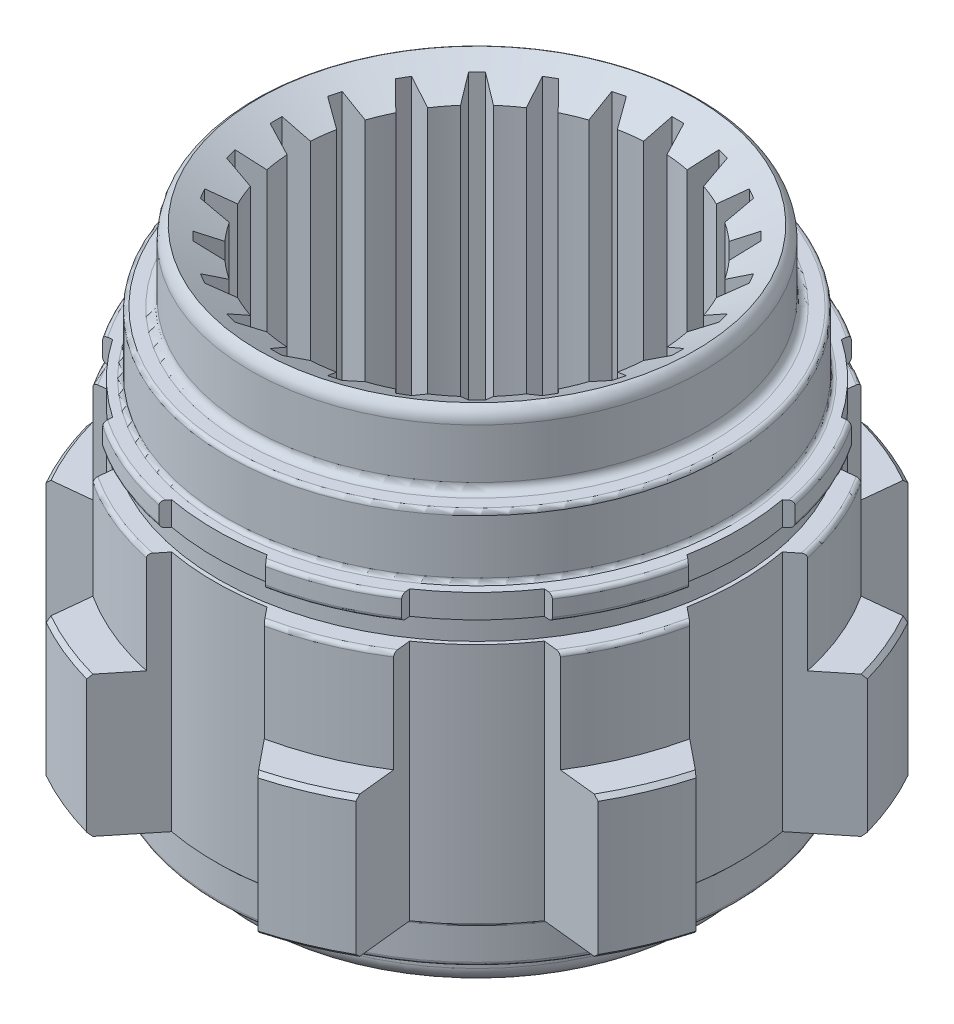
from build123d import *
from OCP.BRepFilletAPI import BRepFilletAPI_MakeChamfer

# Parameters (mm, degrees)
CHAMFER1_SIZE         = 5
CHAMFER1_SIZE2        = 2.886751346
CUT_EXTRUDE1_DEPTH    = 80
FILETE1_R             = 2
FILETE2_R             = 1
FILETE3_R             = 0.5
CHANFRO1_SIZE         = 0.5
FILETE4_R             = 2
FILETE5_R             = 0.5
CORTE_EXTRUS_O1_DEPTH = 85.528368019


with BuildPart() as part:
    # Esboço1 → Revolução1 (revolve)
    with BuildSketch(Plane.XY, mode=Mode.PRIVATE) as revolu_o1_sk:
        Polygon((22.5, 50.818468468), (28.5, 50.818468468), (28.5, 41.818468468), (31.5, 41.818468468), (31.5, 34.018468468), (34, 34.018468468), (34, 31.018468468), (32.5, 31.018468468), (32.5, 28.318468468), (35, 28.318468468), (35, 15.518468468), (39.85, 15.518468468), (39.85, -2.181531532), (32.5, -2.181531532), (32.5, -7.181531532), (28.5, -7.181531532), (28.5, -12.181531532), (22.5, -12.181531532), align=None)
    revolve(revolu_o1_sk.sketch.rotate(Axis((0, -54.461261261, 0), (0, 1, 0)), 90), axis=Axis((0, -54.461261261, 0), (0, 1, 0)))

    # Chamfer1: one chamfer whose edges measure the first distance from different faces: ONE call of the kernel's chamfer builder (chamfer() names one face for all edges)
    chamfer1_edges_1 = [part.edges().sort_by_distance(p)[0] for p in [
        (0, -12.181531532, 22.5),
    ]]
    chamfer1_side_1 = [part.faces().sort_by_distance(p)[0] for p in [
        (0, 19.318468468, 22.5),
    ]]
    chamfer1_edges_2 = [part.edges().sort_by_distance(p)[0] for p in [
        (0, 50.818468468, 22.5),
    ]]
    chamfer1_side_2 = [part.faces().sort_by_distance(p)[0] for p in [
        (0, 50.818468468, 23.306101731),
    ]]
    chamfer1 = BRepFilletAPI_MakeChamfer(part.part.solid().wrapped)
    for e in chamfer1_edges_1:
        chamfer1.Add(CHAMFER1_SIZE, CHAMFER1_SIZE2, e.wrapped, chamfer1_side_1[0].wrapped)  # the first distance lies on this face
    for e in chamfer1_edges_2:
        chamfer1.Add(CHAMFER1_SIZE, CHAMFER1_SIZE2, e.wrapped, chamfer1_side_2[0].wrapped)  # the first distance lies on this face
    add(Compound.cast(chamfer1.Shape()), mode=Mode.REPLACE)

    # Sketch1 → Cut-Extrude1 (cut)
    with BuildSketch(Plane(origin=(0, 50.818468468, 0), x_dir=(1, 0, 0), z_dir=(0, 1, 0))):
        Polygon((-1.5, 22.32144919), (1.5, 22.32144919), (0.75, 25.3), (-0.75, 25.3), align=None)
        Polygon((4.328327425, 21.94909282), (7.226104904, 21.172635685), (7.272566211, 24.243809121), (5.823677471, 24.632037689), align=None)
        Polygon((9.861686489, 20.080942048), (12.459762701, 18.580942048), (13.299519053, 21.535442716), (12.000480947, 22.285442716), align=None)
        Polygon((14.722987916, 16.84430826), (16.84430826, 14.722987916), (18.42013165, 17.359471478), (17.359471478, 18.42013165), align=None)
        Polygon((18.580942048, 12.459762701), (20.080942048, 9.861686489), (22.285442716, 12.000480947), (21.535442716, 13.299519053), align=None)
        Polygon((21.172635685, 7.226104904), (21.94909282, 4.328327425), (24.632037689, 5.823677471), (24.243809121, 7.272566211), align=None)
        Polygon((22.32144919, 1.5), (22.32144919, -1.5), (25.3, -0.75), (25.3, 0.75), align=None)
        Polygon((21.94909282, -4.328327425), (21.172635685, -7.226104904), (24.243809121, -7.272566211), (24.632037689, -5.823677471), align=None)
        Polygon((20.080942048, -9.861686489), (18.580942048, -12.459762701), (21.535442716, -13.299519053), (22.285442716, -12.000480947), align=None)
        Polygon((16.84430826, -14.722987916), (14.722987916, -16.84430826), (17.359471478, -18.42013165), (18.42013165, -17.359471478), align=None)
        Polygon((12.459762701, -18.580942048), (9.861686489, -20.080942048), (12.000480947, -22.285442716), (13.299519053, -21.535442716), align=None)
        Polygon((7.226104904, -21.172635685), (4.328327425, -21.94909282), (5.823677471, -24.632037689), (7.272566211, -24.243809121), align=None)
        Polygon((1.5, -22.32144919), (-1.5, -22.32144919), (-0.75, -25.3), (0.75, -25.3), align=None)
        Polygon((-4.328327425, -21.94909282), (-7.226104904, -21.172635685), (-7.272566211, -24.243809121), (-5.823677471, -24.632037689), align=None)
        Polygon((-9.861686489, -20.080942048), (-12.459762701, -18.580942048), (-13.299519053, -21.535442716), (-12.000480947, -22.285442716), align=None)
        Polygon((-14.722987916, -16.84430826), (-16.84430826, -14.722987916), (-18.42013165, -17.359471478), (-17.359471478, -18.42013165), align=None)
        Polygon((-18.580942048, -12.459762701), (-20.080942048, -9.861686489), (-22.285442716, -12.000480947), (-21.535442716, -13.299519053), align=None)
        Polygon((-21.172635685, -7.226104904), (-21.94909282, -4.328327425), (-24.632037689, -5.823677471), (-24.243809121, -7.272566211), align=None)
        Polygon((-22.32144919, -1.5), (-22.32144919, 1.5), (-25.3, 0.75), (-25.3, -0.75), align=None)
        Polygon((-21.94909282, 4.328327425), (-21.172635685, 7.226104904), (-24.243809121, 7.272566211), (-24.632037689, 5.823677471), align=None)
        Polygon((-20.080942048, 9.861686489), (-18.580942048, 12.459762701), (-21.535442716, 13.299519053), (-22.285442716, 12.000480947), align=None)
        Polygon((-16.84430826, 14.722987916), (-14.722987916, 16.84430826), (-17.359471478, 18.42013165), (-18.42013165, 17.359471478), align=None)
        Polygon((-12.459762701, 18.580942048), (-9.861686489, 20.080942048), (-12.000480947, 22.285442716), (-13.299519053, 21.535442716), align=None)
        Polygon((-7.226104904, 21.172635685), (-4.328327425, 21.94909282), (-5.823677471, 24.632037689), (-7.272566211, 24.243809121), align=None)
    extrude(amount=-CUT_EXTRUDE1_DEPTH, mode=Mode.SUBTRACT)

    # Filete1
    # the kernel refuses this fillet: 2 mm, written as the material it takes off along each edge
    with BuildSketch(Plane(origin=(0, 50.818468468, 0), x_dir=(0, 0, -1), z_dir=(1, 0, 0))) as filete1_piece_1:
        with BuildLine():
            CenterArc((26.5, -1.732050808), FILETE1_R, 0, 60)
            Line((28.5, -1.732050808), (28.54, -1.732050808))
            Line((28.54, -1.732050808), (28.54, 0))
            Line((28.54, 0), (28.5, 0.04))
            ThreePointArc((28.5, 0.04), (28, 0.04), (27.52, 0.034641016))
            Line((27.52, 0.034641016), (27.5, 0))
        make_face()
    revolve(axis=Axis((0, 50.818468468, 0), (0, 1, 0)), mode=Mode.SUBTRACT)

    # Filete2
    filete2_edges = [part.edges().sort_by_distance(p)[0] for p in [
        (0, 41.818468468, 28.5),
    ]]
    fillet(filete2_edges, radius=FILETE2_R)

    # Filete3
    filete3_edges = [part.edges().sort_by_distance(p)[0] for p in [
        (0, 28.318468468, 35),
        (0, 31.018468468, 34),
        (0, 34.018468468, 34),
        (0, 34.018468468, 31.5),
        (0, 41.818468468, 31.5),
    ]]
    fillet(filete3_edges, radius=FILETE3_R)

    # Chanfro1
    chanfro1_edges = [part.edges().sort_by_distance(p)[0] for p in [
        (0, -2.181531532, 39.85),
        (0, 15.518468468, 39.85),
    ]]
    chamfer(chanfro1_edges, length=CHANFRO1_SIZE)

    # Filete4
    filete4_edges = [part.edges().sort_by_distance(p)[0] for p in [
        (0, -12.181531532, 28.5),
    ]]
    fillet(filete4_edges, radius=FILETE4_R)

    # Filete5
    filete5_edges = [part.edges().sort_by_distance(p)[0] for p in [
        (0, -7.181531532, 28.5),
        (0, -7.181531532, 32.5),
        (0, -2.181531532, 32.5),
    ]]
    fillet(filete5_edges, radius=FILETE5_R)

    # Esboço2 → Corte-extrusão1 (cut, through all)
    with BuildSketch(Plane.XZ.offset(12.181531532)):
        with BuildLine():
            ThreePointArc((6, -32.449961479), (0, -33), (-6, -32.449961479))
            Line((-6, -32.449961479), (-13.697117838, -41.95511041))
            Line((-13.697117838, -41.95511041), (13.697117838, -41.95511041))
            Line((13.697117838, -41.95511041), (6, -32.449961479))
        make_face()
        with BuildLine():
            ThreePointArc((-18.702947124, -27.188228498), (-23.334523779, -23.334523779), (-27.188228498, -18.702947124))
            Line((-27.188228498, -18.702947124), (-39.352067982, -19.981418171))
            Line((-39.352067982, -19.981418171), (-19.981418171, -39.352067982))
            Line((-19.981418171, -39.352067982), (-18.702947124, -27.188228498))
        make_face()
        with BuildLine():
            ThreePointArc((-32.449961479, -6), (-33, 0), (-32.449961479, 6))
            Line((-32.449961479, 6), (-41.95511041, 13.697117838))
            Line((-41.95511041, 13.697117838), (-41.95511041, -13.697117838))
            Line((-41.95511041, -13.697117838), (-32.449961479, -6))
        make_face()
        with BuildLine():
            ThreePointArc((-27.188228498, 18.702947124), (-23.334523779, 23.334523779), (-18.702947124, 27.188228498))
            Line((-18.702947124, 27.188228498), (-19.981418171, 39.352067982))
            Line((-19.981418171, 39.352067982), (-39.352067982, 19.981418171))
            Line((-39.352067982, 19.981418171), (-27.188228498, 18.702947124))
        make_face()
        with BuildLine():
            ThreePointArc((-6, 32.449961479), (0, 33), (6, 32.449961479))
            Line((6, 32.449961479), (13.697117838, 41.95511041))
            Line((13.697117838, 41.95511041), (-13.697117838, 41.95511041))
            Line((-13.697117838, 41.95511041), (-6, 32.449961479))
        make_face()
        with BuildLine():
            ThreePointArc((18.702947124, 27.188228498), (23.334523779, 23.334523779), (27.188228498, 18.702947124))
            Line((27.188228498, 18.702947124), (39.352067982, 19.981418171))
            Line((39.352067982, 19.981418171), (19.981418171, 39.352067982))
            Line((19.981418171, 39.352067982), (18.702947124, 27.188228498))
        make_face()
        with BuildLine():
            ThreePointArc((32.449961479, 6), (33, 0), (32.449961479, -6))
            Line((32.449961479, -6), (41.95511041, -13.697117838))
            Line((41.95511041, -13.697117838), (41.95511041, 13.697117838))
            Line((41.95511041, 13.697117838), (32.449961479, 6))
        make_face()
        with BuildLine():
            ThreePointArc((27.188228498, -18.702947124), (23.334523779, -23.334523779), (18.702947124, -27.188228498))
            Line((18.702947124, -27.188228498), (19.981418171, -39.352067982))
            Line((19.981418171, -39.352067982), (39.352067982, -19.981418171))
            Line((39.352067982, -19.981418171), (27.188228498, -18.702947124))
        make_face()
    extrude(amount=-CORTE_EXTRUS_O1_DEPTH, mode=Mode.SUBTRACT)


solid = part.part
